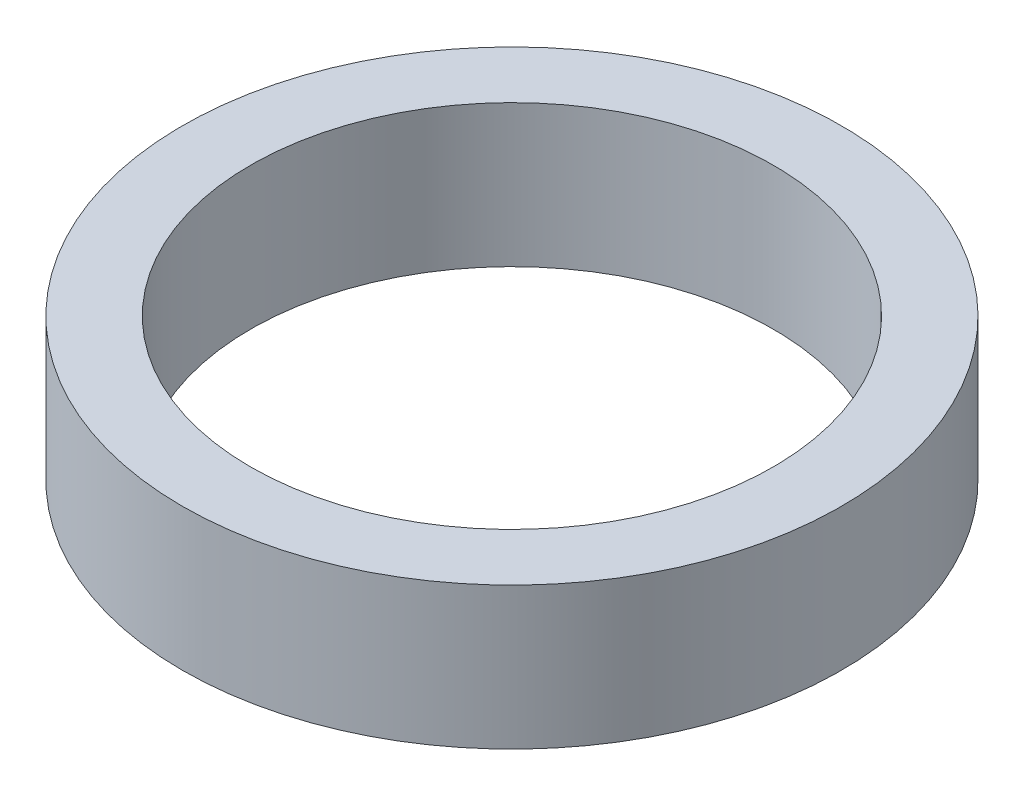
from build123d import *

# Parameters (mm, degrees)
SKETCH1_R           = 290
BOSS_EXTRUDE1_DEPTH = 125
SKETCH2_R           = 230
CUT_EXTRUDE1_DEPTH  = 429.748177839


with BuildPart() as part:
    # Sketch1 → Boss-Extrude1 (new body)
    with BuildSketch(Plane(origin=(0, 0, 0), x_dir=(1, 0, 0), z_dir=(0, 1, 0))):
        Circle(SKETCH1_R)
    extrude(amount=BOSS_EXTRUDE1_DEPTH)

    # Sketch2 → Cut-Extrude1 (cut, through all)
    with BuildSketch(Plane(origin=(0, 125, 0), x_dir=(1, 0, 0), z_dir=(0, 1, 0))):
        Circle(SKETCH2_R)
    extrude(amount=-CUT_EXTRUDE1_DEPTH, mode=Mode.SUBTRACT)


solid = part.part
